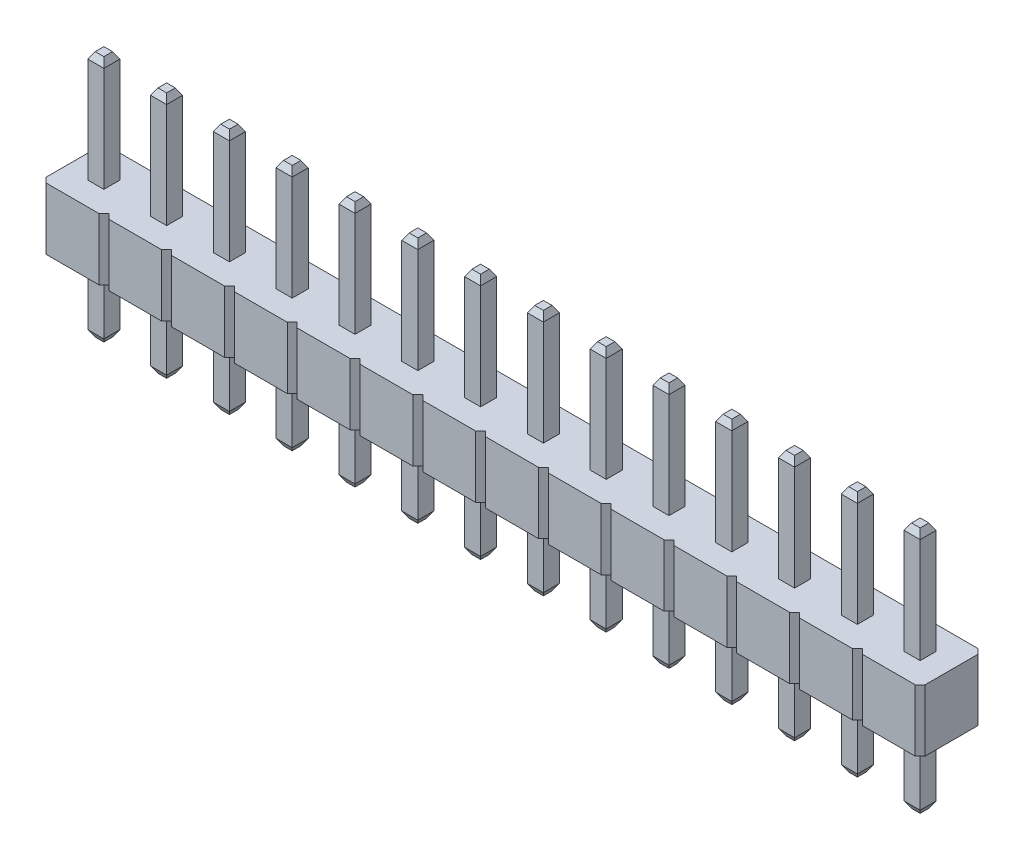
from build123d import *

# Parameters (mm, degrees)
BOSS_EXTRUDE1_DEPTH   = 2.5
SKETCH3_W             = 0.65
SKETCH3_H             = 0.65
BOSS_EXTRUDE2_DEPTH   = 10
CHAMFER2_SIZE         = 0.15
CHAMFER2_SIZE2        = 0.259807621
CHAMFER3_SIZE         = 0.15
CHAMFER3_SIZE2        = 0.259807621
LPATTERN2_DEPTH       = 2.5
LPATTERN2_START       = -2.740192379
LPATTERN2_2_OUTLINE_W = 0.65
LPATTERN2_2_OUTLINE_H = 0.65
LPATTERN2_2_DEPTH     = 9.480384758


with BuildPart() as part:
    # Sketch1 → Boss-Extrude1 (new body)
    with BuildSketch(Plane(origin=(0, 0, 0), x_dir=(1, 0, 0), z_dir=(0, 1, 0))):
        Polygon((-7.42, 1.27), (-7.62, 1.07), (-7.62, -1.07), (-7.42, -1.27), (-5.28, -1.27), (-5.08, -1.07), (-5.08, 1.07), (-5.28, 1.27), align=None)
    extrude(amount=BOSS_EXTRUDE1_DEPTH)

    # Sketch3 → Boss-Extrude2 (add)
    with BuildSketch(Plane(origin=(0, -3, 0), x_dir=(1, 0, 0), z_dir=(0, 1, 0))):
        with Locations((-6.35, 0)):
            Rectangle(SKETCH3_W, SKETCH3_H)
    extrude(amount=BOSS_EXTRUDE2_DEPTH)

    # Chamfer2
    chamfer2_edges = [part.edges().sort_by_distance(p)[0] for p in [
        (-6.025, -3, 0),
        (-6.35, -3, -0.325),
        (-6.675, -3, 0),
        (-6.35, -3, 0.325),
    ]]
    chamfer2_side = [part.faces().sort_by_distance(p)[0] for p in [
        (-6.35, -3, 0),
    ]]
    chamfer(chamfer2_edges, length=CHAMFER2_SIZE, length2=CHAMFER2_SIZE2, reference=chamfer2_side[0])

    # Chamfer3
    chamfer3_edges = [part.edges().sort_by_distance(p)[0] for p in [
        (-6.025, 7, 0),
        (-6.35, 7, -0.325),
        (-6.675, 7, 0),
        (-6.35, 7, 0.325),
    ]]
    chamfer3_side = [part.faces().sort_by_distance(p)[0] for p in [
        (-6.35, 7, 0),
    ]]
    chamfer(chamfer3_edges, length=CHAMFER3_SIZE, length2=CHAMFER3_SIZE2, reference=chamfer3_side[0])

    # LPattern2: read off the stored shape, not the designer's step
    # LPattern2 outline → LPattern2 (add)
    with BuildSketch(Plane(origin=(0, 0, 0), x_dir=(1, 0, 0), z_dir=(0, 1, 0))):
        Polygon((-2.74, 1.27), (-4.88, 1.27), (-5.08, 1.07), (-5.08, -1.07), (-4.88, -1.27), (-2.74, -1.27), (-2.54, -1.07), (-2.34, -1.27), (-0.2, -1.27), (0, -1.07), (0.2, -1.27), (2.34, -1.27), (2.54, -1.07), (2.74, -1.27), (4.88, -1.27), (5.08, -1.07), (5.28, -1.27), (7.42, -1.27), (7.62, -1.07), (7.82, -1.27), (9.96, -1.27), (10.16, -1.07), (10.36, -1.27), (12.5, -1.27), (12.7, -1.07), (12.9, -1.27), (15.04, -1.27), (15.24, -1.07), (15.44, -1.27), (17.58, -1.27), (17.78, -1.07), (17.98, -1.27), (20.12, -1.27), (20.32, -1.07), (20.52, -1.27), (22.66, -1.27), (22.86, -1.07), (23.06, -1.27), (25.2, -1.27), (25.4, -1.07), (25.6, -1.27), (27.74, -1.27), (27.94, -1.07), (27.94, 1.07), (27.74, 1.27), (25.6, 1.27), (25.4, 1.07), (25.2, 1.27), (23.06, 1.27), (22.86, 1.07), (22.66, 1.27), (20.52, 1.27), (20.32, 1.07), (20.12, 1.27), (17.98, 1.27), (17.78, 1.07), (17.58, 1.27), (15.44, 1.27), (15.24, 1.07), (15.04, 1.27), (12.9, 1.27), (12.7, 1.07), (12.5, 1.27), (10.36, 1.27), (10.16, 1.07), (9.96, 1.27), (7.82, 1.27), (7.62, 1.07), (7.42, 1.27), (5.28, 1.27), (5.08, 1.07), (4.88, 1.27), (2.74, 1.27), (2.54, 1.07), (2.34, 1.27), (0.2, 1.27), (0, 1.07), (-0.2, 1.27), (-2.34, 1.27), (-2.54, 1.07), align=None)
    extrude(amount=LPATTERN2_DEPTH)

    # LPattern2 2 outline → LPattern2 2 (add)
    with BuildSketch(Plane(origin=(0, 0, 0), x_dir=(1, 0, 0), z_dir=(0, 1, 0)).offset(LPATTERN2_START)):
        with Locations((-3.81, 0)):
            Rectangle(LPATTERN2_2_OUTLINE_W, LPATTERN2_2_OUTLINE_H)
        with Locations((-1.27, 0)):
            Rectangle(LPATTERN2_2_OUTLINE_W, LPATTERN2_2_OUTLINE_H)
        with Locations((1.27, 0)):
            Rectangle(LPATTERN2_2_OUTLINE_W, LPATTERN2_2_OUTLINE_H)
        with Locations((3.81, 0)):
            Rectangle(LPATTERN2_2_OUTLINE_W, LPATTERN2_2_OUTLINE_H)
        with Locations((6.35, 0)):
            Rectangle(LPATTERN2_2_OUTLINE_W, LPATTERN2_2_OUTLINE_H)
        with Locations((8.89, 0)):
            Rectangle(LPATTERN2_2_OUTLINE_W, LPATTERN2_2_OUTLINE_H)
        with Locations((11.43, 0)):
            Rectangle(LPATTERN2_2_OUTLINE_W, LPATTERN2_2_OUTLINE_H)
        with Locations((13.97, 0)):
            Rectangle(LPATTERN2_2_OUTLINE_W, LPATTERN2_2_OUTLINE_H)
        with Locations((16.51, 0)):
            Rectangle(LPATTERN2_2_OUTLINE_W, LPATTERN2_2_OUTLINE_H)
        with Locations((19.05, 0)):
            Rectangle(LPATTERN2_2_OUTLINE_W, LPATTERN2_2_OUTLINE_H)
        with Locations((21.59, 0)):
            Rectangle(LPATTERN2_2_OUTLINE_W, LPATTERN2_2_OUTLINE_H)
        with Locations((24.13, 0)):
            Rectangle(LPATTERN2_2_OUTLINE_W, LPATTERN2_2_OUTLINE_H)
        with Locations((26.67, 0)):
            Rectangle(LPATTERN2_2_OUTLINE_W, LPATTERN2_2_OUTLINE_H)
    extrude(amount=LPATTERN2_2_DEPTH)

    # LPattern2 3: loft between two sections, ruled curve by curve
    lpattern2_3_from = [
        Edge.make_line((-3.985, -3, 0.175), (-3.635, -3, 0.175)),
        Edge.make_line((-3.635, -3, -0.175), (-3.985, -3, -0.175)),
        Edge.make_line((-3.635, -3, 0.175), (-3.635, -3, -0.175)),
        Edge.make_line((-3.985, -3, 0.175), (-3.985, -3, -0.175)),
    ]
    lpattern2_3_to = [
        Edge.make_line((-4.135, -2.740192379, 0.325), (-3.485, -2.740192379, 0.325)),
        Edge.make_line((-3.485, -2.740192379, -0.325), (-4.135, -2.740192379, -0.325)),
        Edge.make_line((-3.485, -2.740192379, 0.325), (-3.485, -2.740192379, -0.325)),
        Edge.make_line((-4.135, -2.740192379, 0.325), (-4.135, -2.740192379, -0.325)),
    ]
    lpattern2_3 = Solid(Shell([*[Face.make_surface_from_curves(lpattern2_3_from[k], lpattern2_3_to[k]) for k in range(4)], Face(Wire(lpattern2_3_from)), Face(Wire(lpattern2_3_to))]))
    add(lpattern2_3)

    # LPattern2 4: loft between two sections, ruled curve by curve
    lpattern2_4_from = [
        Edge.make_line((-1.445, -3, 0.175), (-1.095, -3, 0.175)),
        Edge.make_line((-1.095, -3, -0.175), (-1.445, -3, -0.175)),
        Edge.make_line((-1.095, -3, 0.175), (-1.095, -3, -0.175)),
        Edge.make_line((-1.445, -3, 0.175), (-1.445, -3, -0.175)),
    ]
    lpattern2_4_to = [
        Edge.make_line((-1.595, -2.740192379, 0.325), (-0.945, -2.740192379, 0.325)),
        Edge.make_line((-0.945, -2.740192379, -0.325), (-1.595, -2.740192379, -0.325)),
        Edge.make_line((-0.945, -2.740192379, 0.325), (-0.945, -2.740192379, -0.325)),
        Edge.make_line((-1.595, -2.740192379, 0.325), (-1.595, -2.740192379, -0.325)),
    ]
    lpattern2_4 = Solid(Shell([*[Face.make_surface_from_curves(lpattern2_4_from[k], lpattern2_4_to[k]) for k in range(4)], Face(Wire(lpattern2_4_from)), Face(Wire(lpattern2_4_to))]))
    add(lpattern2_4)

    # LPattern2 5: loft between two sections, ruled curve by curve
    lpattern2_5_from = [
        Edge.make_line((1.095, -3, 0.175), (1.445, -3, 0.175)),
        Edge.make_line((1.445, -3, -0.175), (1.095, -3, -0.175)),
        Edge.make_line((1.445, -3, 0.175), (1.445, -3, -0.175)),
        Edge.make_line((1.095, -3, 0.175), (1.095, -3, -0.175)),
    ]
    lpattern2_5_to = [
        Edge.make_line((0.945, -2.740192379, 0.325), (1.595, -2.740192379, 0.325)),
        Edge.make_line((1.595, -2.740192379, -0.325), (0.945, -2.740192379, -0.325)),
        Edge.make_line((1.595, -2.740192379, 0.325), (1.595, -2.740192379, -0.325)),
        Edge.make_line((0.945, -2.740192379, 0.325), (0.945, -2.740192379, -0.325)),
    ]
    lpattern2_5 = Solid(Shell([*[Face.make_surface_from_curves(lpattern2_5_from[k], lpattern2_5_to[k]) for k in range(4)], Face(Wire(lpattern2_5_from)), Face(Wire(lpattern2_5_to))]))
    add(lpattern2_5)

    # LPattern2 6: loft between two sections, ruled curve by curve
    lpattern2_6_from = [
        Edge.make_line((3.635, -3, 0.175), (3.985, -3, 0.175)),
        Edge.make_line((3.985, -3, -0.175), (3.635, -3, -0.175)),
        Edge.make_line((3.985, -3, 0.175), (3.985, -3, -0.175)),
        Edge.make_line((3.635, -3, 0.175), (3.635, -3, -0.175)),
    ]
    lpattern2_6_to = [
        Edge.make_line((3.485, -2.740192379, 0.325), (4.135, -2.740192379, 0.325)),
        Edge.make_line((4.135, -2.740192379, -0.325), (3.485, -2.740192379, -0.325)),
        Edge.make_line((4.135, -2.740192379, 0.325), (4.135, -2.740192379, -0.325)),
        Edge.make_line((3.485, -2.740192379, 0.325), (3.485, -2.740192379, -0.325)),
    ]
    lpattern2_6 = Solid(Shell([*[Face.make_surface_from_curves(lpattern2_6_from[k], lpattern2_6_to[k]) for k in range(4)], Face(Wire(lpattern2_6_from)), Face(Wire(lpattern2_6_to))]))
    add(lpattern2_6)

    # LPattern2 7: loft between two sections, ruled curve by curve
    lpattern2_7_from = [
        Edge.make_line((6.175, -3, 0.175), (6.525, -3, 0.175)),
        Edge.make_line((6.525, -3, -0.175), (6.175, -3, -0.175)),
        Edge.make_line((6.525, -3, 0.175), (6.525, -3, -0.175)),
        Edge.make_line((6.175, -3, 0.175), (6.175, -3, -0.175)),
    ]
    lpattern2_7_to = [
        Edge.make_line((6.025, -2.740192379, 0.325), (6.675, -2.740192379, 0.325)),
        Edge.make_line((6.675, -2.740192379, -0.325), (6.025, -2.740192379, -0.325)),
        Edge.make_line((6.675, -2.740192379, 0.325), (6.675, -2.740192379, -0.325)),
        Edge.make_line((6.025, -2.740192379, 0.325), (6.025, -2.740192379, -0.325)),
    ]
    lpattern2_7 = Solid(Shell([*[Face.make_surface_from_curves(lpattern2_7_from[k], lpattern2_7_to[k]) for k in range(4)], Face(Wire(lpattern2_7_from)), Face(Wire(lpattern2_7_to))]))
    add(lpattern2_7)

    # LPattern2 8: loft between two sections, ruled curve by curve
    lpattern2_8_from = [
        Edge.make_line((8.715, -3, 0.175), (9.065, -3, 0.175)),
        Edge.make_line((9.065, -3, -0.175), (8.715, -3, -0.175)),
        Edge.make_line((9.065, -3, 0.175), (9.065, -3, -0.175)),
        Edge.make_line((8.715, -3, 0.175), (8.715, -3, -0.175)),
    ]
    lpattern2_8_to = [
        Edge.make_line((8.565, -2.740192379, 0.325), (9.215, -2.740192379, 0.325)),
        Edge.make_line((9.215, -2.740192379, -0.325), (8.565, -2.740192379, -0.325)),
        Edge.make_line((9.215, -2.740192379, 0.325), (9.215, -2.740192379, -0.325)),
        Edge.make_line((8.565, -2.740192379, 0.325), (8.565, -2.740192379, -0.325)),
    ]
    lpattern2_8 = Solid(Shell([*[Face.make_surface_from_curves(lpattern2_8_from[k], lpattern2_8_to[k]) for k in range(4)], Face(Wire(lpattern2_8_from)), Face(Wire(lpattern2_8_to))]))
    add(lpattern2_8)

    # LPattern2 9: loft between two sections, ruled curve by curve
    lpattern2_9_from = [
        Edge.make_line((11.255, -3, 0.175), (11.605, -3, 0.175)),
        Edge.make_line((11.605, -3, -0.175), (11.255, -3, -0.175)),
        Edge.make_line((11.605, -3, 0.175), (11.605, -3, -0.175)),
        Edge.make_line((11.255, -3, 0.175), (11.255, -3, -0.175)),
    ]
    lpattern2_9_to = [
        Edge.make_line((11.105, -2.740192379, 0.325), (11.755, -2.740192379, 0.325)),
        Edge.make_line((11.755, -2.740192379, -0.325), (11.105, -2.740192379, -0.325)),
        Edge.make_line((11.755, -2.740192379, 0.325), (11.755, -2.740192379, -0.325)),
        Edge.make_line((11.105, -2.740192379, 0.325), (11.105, -2.740192379, -0.325)),
    ]
    lpattern2_9 = Solid(Shell([*[Face.make_surface_from_curves(lpattern2_9_from[k], lpattern2_9_to[k]) for k in range(4)], Face(Wire(lpattern2_9_from)), Face(Wire(lpattern2_9_to))]))
    add(lpattern2_9)

    # LPattern2 10: loft between two sections, ruled curve by curve
    lpattern2_10_from = [
        Edge.make_line((13.795, -3, 0.175), (14.145, -3, 0.175)),
        Edge.make_line((14.145, -3, -0.175), (13.795, -3, -0.175)),
        Edge.make_line((14.145, -3, 0.175), (14.145, -3, -0.175)),
        Edge.make_line((13.795, -3, 0.175), (13.795, -3, -0.175)),
    ]
    lpattern2_10_to = [
        Edge.make_line((13.645, -2.740192379, 0.325), (14.295, -2.740192379, 0.325)),
        Edge.make_line((14.295, -2.740192379, -0.325), (13.645, -2.740192379, -0.325)),
        Edge.make_line((14.295, -2.740192379, 0.325), (14.295, -2.740192379, -0.325)),
        Edge.make_line((13.645, -2.740192379, 0.325), (13.645, -2.740192379, -0.325)),
    ]
    lpattern2_10 = Solid(Shell([*[Face.make_surface_from_curves(lpattern2_10_from[k], lpattern2_10_to[k]) for k in range(4)], Face(Wire(lpattern2_10_from)), Face(Wire(lpattern2_10_to))]))
    add(lpattern2_10)

    # LPattern2 11: loft between two sections, ruled curve by curve
    lpattern2_11_from = [
        Edge.make_line((16.335, -3, 0.175), (16.685, -3, 0.175)),
        Edge.make_line((16.685, -3, -0.175), (16.335, -3, -0.175)),
        Edge.make_line((16.685, -3, 0.175), (16.685, -3, -0.175)),
        Edge.make_line((16.335, -3, 0.175), (16.335, -3, -0.175)),
    ]
    lpattern2_11_to = [
        Edge.make_line((16.185, -2.740192379, 0.325), (16.835, -2.740192379, 0.325)),
        Edge.make_line((16.835, -2.740192379, -0.325), (16.185, -2.740192379, -0.325)),
        Edge.make_line((16.835, -2.740192379, 0.325), (16.835, -2.740192379, -0.325)),
        Edge.make_line((16.185, -2.740192379, 0.325), (16.185, -2.740192379, -0.325)),
    ]
    lpattern2_11 = Solid(Shell([*[Face.make_surface_from_curves(lpattern2_11_from[k], lpattern2_11_to[k]) for k in range(4)], Face(Wire(lpattern2_11_from)), Face(Wire(lpattern2_11_to))]))
    add(lpattern2_11)

    # LPattern2 12: loft between two sections, ruled curve by curve
    lpattern2_12_from = [
        Edge.make_line((18.875, -3, 0.175), (19.225, -3, 0.175)),
        Edge.make_line((19.225, -3, -0.175), (18.875, -3, -0.175)),
        Edge.make_line((19.225, -3, 0.175), (19.225, -3, -0.175)),
        Edge.make_line((18.875, -3, 0.175), (18.875, -3, -0.175)),
    ]
    lpattern2_12_to = [
        Edge.make_line((18.725, -2.740192379, 0.325), (19.375, -2.740192379, 0.325)),
        Edge.make_line((19.375, -2.740192379, -0.325), (18.725, -2.740192379, -0.325)),
        Edge.make_line((19.375, -2.740192379, 0.325), (19.375, -2.740192379, -0.325)),
        Edge.make_line((18.725, -2.740192379, 0.325), (18.725, -2.740192379, -0.325)),
    ]
    lpattern2_12 = Solid(Shell([*[Face.make_surface_from_curves(lpattern2_12_from[k], lpattern2_12_to[k]) for k in range(4)], Face(Wire(lpattern2_12_from)), Face(Wire(lpattern2_12_to))]))
    add(lpattern2_12)

    # LPattern2 13: loft between two sections, ruled curve by curve
    lpattern2_13_from = [
        Edge.make_line((21.415, -3, 0.175), (21.765, -3, 0.175)),
        Edge.make_line((21.765, -3, -0.175), (21.415, -3, -0.175)),
        Edge.make_line((21.765, -3, 0.175), (21.765, -3, -0.175)),
        Edge.make_line((21.415, -3, 0.175), (21.415, -3, -0.175)),
    ]
    lpattern2_13_to = [
        Edge.make_line((21.265, -2.740192379, 0.325), (21.915, -2.740192379, 0.325)),
        Edge.make_line((21.915, -2.740192379, -0.325), (21.265, -2.740192379, -0.325)),
        Edge.make_line((21.915, -2.740192379, 0.325), (21.915, -2.740192379, -0.325)),
        Edge.make_line((21.265, -2.740192379, 0.325), (21.265, -2.740192379, -0.325)),
    ]
    lpattern2_13 = Solid(Shell([*[Face.make_surface_from_curves(lpattern2_13_from[k], lpattern2_13_to[k]) for k in range(4)], Face(Wire(lpattern2_13_from)), Face(Wire(lpattern2_13_to))]))
    add(lpattern2_13)

    # LPattern2 14: loft between two sections, ruled curve by curve
    lpattern2_14_from = [
        Edge.make_line((23.955, -3, 0.175), (24.305, -3, 0.175)),
        Edge.make_line((24.305, -3, -0.175), (23.955, -3, -0.175)),
        Edge.make_line((24.305, -3, 0.175), (24.305, -3, -0.175)),
        Edge.make_line((23.955, -3, 0.175), (23.955, -3, -0.175)),
    ]
    lpattern2_14_to = [
        Edge.make_line((23.805, -2.740192379, 0.325), (24.455, -2.740192379, 0.325)),
        Edge.make_line((24.455, -2.740192379, -0.325), (23.805, -2.740192379, -0.325)),
        Edge.make_line((24.455, -2.740192379, 0.325), (24.455, -2.740192379, -0.325)),
        Edge.make_line((23.805, -2.740192379, 0.325), (23.805, -2.740192379, -0.325)),
    ]
    lpattern2_14 = Solid(Shell([*[Face.make_surface_from_curves(lpattern2_14_from[k], lpattern2_14_to[k]) for k in range(4)], Face(Wire(lpattern2_14_from)), Face(Wire(lpattern2_14_to))]))
    add(lpattern2_14)

    # LPattern2 15: loft between two sections, ruled curve by curve
    lpattern2_15_from = [
        Edge.make_line((26.495, -3, 0.175), (26.845, -3, 0.175)),
        Edge.make_line((26.845, -3, -0.175), (26.495, -3, -0.175)),
        Edge.make_line((26.845, -3, 0.175), (26.845, -3, -0.175)),
        Edge.make_line((26.495, -3, 0.175), (26.495, -3, -0.175)),
    ]
    lpattern2_15_to = [
        Edge.make_line((26.345, -2.740192379, 0.325), (26.995, -2.740192379, 0.325)),
        Edge.make_line((26.995, -2.740192379, -0.325), (26.345, -2.740192379, -0.325)),
        Edge.make_line((26.995, -2.740192379, 0.325), (26.995, -2.740192379, -0.325)),
        Edge.make_line((26.345, -2.740192379, 0.325), (26.345, -2.740192379, -0.325)),
    ]
    lpattern2_15 = Solid(Shell([*[Face.make_surface_from_curves(lpattern2_15_from[k], lpattern2_15_to[k]) for k in range(4)], Face(Wire(lpattern2_15_from)), Face(Wire(lpattern2_15_to))]))
    add(lpattern2_15)

    # LPattern2 16: loft between two sections, ruled curve by curve
    lpattern2_16_from = [
        Edge.make_line((-3.485, 6.740192379, -0.325), (-4.135, 6.740192379, -0.325)),
        Edge.make_line((-4.135, 6.740192379, 0.325), (-3.485, 6.740192379, 0.325)),
        Edge.make_line((-4.135, 6.740192379, -0.325), (-4.135, 6.740192379, 0.325)),
        Edge.make_line((-3.485, 6.740192379, -0.325), (-3.485, 6.740192379, 0.325)),
    ]
    lpattern2_16_to = [
        Edge.make_line((-3.635, 7, -0.175), (-3.985, 7, -0.175)),
        Edge.make_line((-3.985, 7, 0.175), (-3.635, 7, 0.175)),
        Edge.make_line((-3.985, 7, -0.175), (-3.985, 7, 0.175)),
        Edge.make_line((-3.635, 7, -0.175), (-3.635, 7, 0.175)),
    ]
    lpattern2_16 = Solid(Shell([*[Face.make_surface_from_curves(lpattern2_16_from[k], lpattern2_16_to[k]) for k in range(4)], Face(Wire(lpattern2_16_from)), Face(Wire(lpattern2_16_to))]))
    add(lpattern2_16)

    # LPattern2 17: loft between two sections, ruled curve by curve
    lpattern2_17_from = [
        Edge.make_line((-0.945, 6.740192379, -0.325), (-1.595, 6.740192379, -0.325)),
        Edge.make_line((-1.595, 6.740192379, 0.325), (-0.945, 6.740192379, 0.325)),
        Edge.make_line((-1.595, 6.740192379, -0.325), (-1.595, 6.740192379, 0.325)),
        Edge.make_line((-0.945, 6.740192379, -0.325), (-0.945, 6.740192379, 0.325)),
    ]
    lpattern2_17_to = [
        Edge.make_line((-1.095, 7, -0.175), (-1.445, 7, -0.175)),
        Edge.make_line((-1.445, 7, 0.175), (-1.095, 7, 0.175)),
        Edge.make_line((-1.445, 7, -0.175), (-1.445, 7, 0.175)),
        Edge.make_line((-1.095, 7, -0.175), (-1.095, 7, 0.175)),
    ]
    lpattern2_17 = Solid(Shell([*[Face.make_surface_from_curves(lpattern2_17_from[k], lpattern2_17_to[k]) for k in range(4)], Face(Wire(lpattern2_17_from)), Face(Wire(lpattern2_17_to))]))
    add(lpattern2_17)

    # LPattern2 18: loft between two sections, ruled curve by curve
    lpattern2_18_from = [
        Edge.make_line((1.595, 6.740192379, -0.325), (0.945, 6.740192379, -0.325)),
        Edge.make_line((0.945, 6.740192379, 0.325), (1.595, 6.740192379, 0.325)),
        Edge.make_line((0.945, 6.740192379, -0.325), (0.945, 6.740192379, 0.325)),
        Edge.make_line((1.595, 6.740192379, -0.325), (1.595, 6.740192379, 0.325)),
    ]
    lpattern2_18_to = [
        Edge.make_line((1.445, 7, -0.175), (1.095, 7, -0.175)),
        Edge.make_line((1.095, 7, 0.175), (1.445, 7, 0.175)),
        Edge.make_line((1.095, 7, -0.175), (1.095, 7, 0.175)),
        Edge.make_line((1.445, 7, -0.175), (1.445, 7, 0.175)),
    ]
    lpattern2_18 = Solid(Shell([*[Face.make_surface_from_curves(lpattern2_18_from[k], lpattern2_18_to[k]) for k in range(4)], Face(Wire(lpattern2_18_from)), Face(Wire(lpattern2_18_to))]))
    add(lpattern2_18)

    # LPattern2 19: loft between two sections, ruled curve by curve
    lpattern2_19_from = [
        Edge.make_line((4.135, 6.740192379, -0.325), (3.485, 6.740192379, -0.325)),
        Edge.make_line((3.485, 6.740192379, 0.325), (4.135, 6.740192379, 0.325)),
        Edge.make_line((3.485, 6.740192379, -0.325), (3.485, 6.740192379, 0.325)),
        Edge.make_line((4.135, 6.740192379, -0.325), (4.135, 6.740192379, 0.325)),
    ]
    lpattern2_19_to = [
        Edge.make_line((3.985, 7, -0.175), (3.635, 7, -0.175)),
        Edge.make_line((3.635, 7, 0.175), (3.985, 7, 0.175)),
        Edge.make_line((3.635, 7, -0.175), (3.635, 7, 0.175)),
        Edge.make_line((3.985, 7, -0.175), (3.985, 7, 0.175)),
    ]
    lpattern2_19 = Solid(Shell([*[Face.make_surface_from_curves(lpattern2_19_from[k], lpattern2_19_to[k]) for k in range(4)], Face(Wire(lpattern2_19_from)), Face(Wire(lpattern2_19_to))]))
    add(lpattern2_19)

    # LPattern2 20: loft between two sections, ruled curve by curve
    lpattern2_20_from = [
        Edge.make_line((6.675, 6.740192379, -0.325), (6.025, 6.740192379, -0.325)),
        Edge.make_line((6.025, 6.740192379, 0.325), (6.675, 6.740192379, 0.325)),
        Edge.make_line((6.025, 6.740192379, -0.325), (6.025, 6.740192379, 0.325)),
        Edge.make_line((6.675, 6.740192379, -0.325), (6.675, 6.740192379, 0.325)),
    ]
    lpattern2_20_to = [
        Edge.make_line((6.525, 7, -0.175), (6.175, 7, -0.175)),
        Edge.make_line((6.175, 7, 0.175), (6.525, 7, 0.175)),
        Edge.make_line((6.175, 7, -0.175), (6.175, 7, 0.175)),
        Edge.make_line((6.525, 7, -0.175), (6.525, 7, 0.175)),
    ]
    lpattern2_20 = Solid(Shell([*[Face.make_surface_from_curves(lpattern2_20_from[k], lpattern2_20_to[k]) for k in range(4)], Face(Wire(lpattern2_20_from)), Face(Wire(lpattern2_20_to))]))
    add(lpattern2_20)

    # LPattern2 21: loft between two sections, ruled curve by curve
    lpattern2_21_from = [
        Edge.make_line((9.215, 6.740192379, -0.325), (8.565, 6.740192379, -0.325)),
        Edge.make_line((8.565, 6.740192379, 0.325), (9.215, 6.740192379, 0.325)),
        Edge.make_line((8.565, 6.740192379, -0.325), (8.565, 6.740192379, 0.325)),
        Edge.make_line((9.215, 6.740192379, -0.325), (9.215, 6.740192379, 0.325)),
    ]
    lpattern2_21_to = [
        Edge.make_line((9.065, 7, -0.175), (8.715, 7, -0.175)),
        Edge.make_line((8.715, 7, 0.175), (9.065, 7, 0.175)),
        Edge.make_line((8.715, 7, -0.175), (8.715, 7, 0.175)),
        Edge.make_line((9.065, 7, -0.175), (9.065, 7, 0.175)),
    ]
    lpattern2_21 = Solid(Shell([*[Face.make_surface_from_curves(lpattern2_21_from[k], lpattern2_21_to[k]) for k in range(4)], Face(Wire(lpattern2_21_from)), Face(Wire(lpattern2_21_to))]))
    add(lpattern2_21)

    # LPattern2 22: loft between two sections, ruled curve by curve
    lpattern2_22_from = [
        Edge.make_line((11.755, 6.740192379, -0.325), (11.105, 6.740192379, -0.325)),
        Edge.make_line((11.105, 6.740192379, 0.325), (11.755, 6.740192379, 0.325)),
        Edge.make_line((11.105, 6.740192379, -0.325), (11.105, 6.740192379, 0.325)),
        Edge.make_line((11.755, 6.740192379, -0.325), (11.755, 6.740192379, 0.325)),
    ]
    lpattern2_22_to = [
        Edge.make_line((11.605, 7, -0.175), (11.255, 7, -0.175)),
        Edge.make_line((11.255, 7, 0.175), (11.605, 7, 0.175)),
        Edge.make_line((11.255, 7, -0.175), (11.255, 7, 0.175)),
        Edge.make_line((11.605, 7, -0.175), (11.605, 7, 0.175)),
    ]
    lpattern2_22 = Solid(Shell([*[Face.make_surface_from_curves(lpattern2_22_from[k], lpattern2_22_to[k]) for k in range(4)], Face(Wire(lpattern2_22_from)), Face(Wire(lpattern2_22_to))]))
    add(lpattern2_22)

    # LPattern2 23: loft between two sections, ruled curve by curve
    lpattern2_23_from = [
        Edge.make_line((14.295, 6.740192379, -0.325), (13.645, 6.740192379, -0.325)),
        Edge.make_line((13.645, 6.740192379, 0.325), (14.295, 6.740192379, 0.325)),
        Edge.make_line((13.645, 6.740192379, -0.325), (13.645, 6.740192379, 0.325)),
        Edge.make_line((14.295, 6.740192379, -0.325), (14.295, 6.740192379, 0.325)),
    ]
    lpattern2_23_to = [
        Edge.make_line((14.145, 7, -0.175), (13.795, 7, -0.175)),
        Edge.make_line((13.795, 7, 0.175), (14.145, 7, 0.175)),
        Edge.make_line((13.795, 7, -0.175), (13.795, 7, 0.175)),
        Edge.make_line((14.145, 7, -0.175), (14.145, 7, 0.175)),
    ]
    lpattern2_23 = Solid(Shell([*[Face.make_surface_from_curves(lpattern2_23_from[k], lpattern2_23_to[k]) for k in range(4)], Face(Wire(lpattern2_23_from)), Face(Wire(lpattern2_23_to))]))
    add(lpattern2_23)

    # LPattern2 24: loft between two sections, ruled curve by curve
    lpattern2_24_from = [
        Edge.make_line((16.835, 6.740192379, -0.325), (16.185, 6.740192379, -0.325)),
        Edge.make_line((16.185, 6.740192379, 0.325), (16.835, 6.740192379, 0.325)),
        Edge.make_line((16.185, 6.740192379, -0.325), (16.185, 6.740192379, 0.325)),
        Edge.make_line((16.835, 6.740192379, -0.325), (16.835, 6.740192379, 0.325)),
    ]
    lpattern2_24_to = [
        Edge.make_line((16.685, 7, -0.175), (16.335, 7, -0.175)),
        Edge.make_line((16.335, 7, 0.175), (16.685, 7, 0.175)),
        Edge.make_line((16.335, 7, -0.175), (16.335, 7, 0.175)),
        Edge.make_line((16.685, 7, -0.175), (16.685, 7, 0.175)),
    ]
    lpattern2_24 = Solid(Shell([*[Face.make_surface_from_curves(lpattern2_24_from[k], lpattern2_24_to[k]) for k in range(4)], Face(Wire(lpattern2_24_from)), Face(Wire(lpattern2_24_to))]))
    add(lpattern2_24)

    # LPattern2 25: loft between two sections, ruled curve by curve
    lpattern2_25_from = [
        Edge.make_line((19.375, 6.740192379, -0.325), (18.725, 6.740192379, -0.325)),
        Edge.make_line((18.725, 6.740192379, 0.325), (19.375, 6.740192379, 0.325)),
        Edge.make_line((18.725, 6.740192379, -0.325), (18.725, 6.740192379, 0.325)),
        Edge.make_line((19.375, 6.740192379, -0.325), (19.375, 6.740192379, 0.325)),
    ]
    lpattern2_25_to = [
        Edge.make_line((19.225, 7, -0.175), (18.875, 7, -0.175)),
        Edge.make_line((18.875, 7, 0.175), (19.225, 7, 0.175)),
        Edge.make_line((18.875, 7, -0.175), (18.875, 7, 0.175)),
        Edge.make_line((19.225, 7, -0.175), (19.225, 7, 0.175)),
    ]
    lpattern2_25 = Solid(Shell([*[Face.make_surface_from_curves(lpattern2_25_from[k], lpattern2_25_to[k]) for k in range(4)], Face(Wire(lpattern2_25_from)), Face(Wire(lpattern2_25_to))]))
    add(lpattern2_25)

    # LPattern2 26: loft between two sections, ruled curve by curve
    lpattern2_26_from = [
        Edge.make_line((21.915, 6.740192379, -0.325), (21.265, 6.740192379, -0.325)),
        Edge.make_line((21.265, 6.740192379, 0.325), (21.915, 6.740192379, 0.325)),
        Edge.make_line((21.265, 6.740192379, -0.325), (21.265, 6.740192379, 0.325)),
        Edge.make_line((21.915, 6.740192379, -0.325), (21.915, 6.740192379, 0.325)),
    ]
    lpattern2_26_to = [
        Edge.make_line((21.765, 7, -0.175), (21.415, 7, -0.175)),
        Edge.make_line((21.415, 7, 0.175), (21.765, 7, 0.175)),
        Edge.make_line((21.415, 7, -0.175), (21.415, 7, 0.175)),
        Edge.make_line((21.765, 7, -0.175), (21.765, 7, 0.175)),
    ]
    lpattern2_26 = Solid(Shell([*[Face.make_surface_from_curves(lpattern2_26_from[k], lpattern2_26_to[k]) for k in range(4)], Face(Wire(lpattern2_26_from)), Face(Wire(lpattern2_26_to))]))
    add(lpattern2_26)

    # LPattern2 27: loft between two sections, ruled curve by curve
    lpattern2_27_from = [
        Edge.make_line((24.455, 6.740192379, -0.325), (23.805, 6.740192379, -0.325)),
        Edge.make_line((23.805, 6.740192379, 0.325), (24.455, 6.740192379, 0.325)),
        Edge.make_line((23.805, 6.740192379, -0.325), (23.805, 6.740192379, 0.325)),
        Edge.make_line((24.455, 6.740192379, -0.325), (24.455, 6.740192379, 0.325)),
    ]
    lpattern2_27_to = [
        Edge.make_line((24.305, 7, -0.175), (23.955, 7, -0.175)),
        Edge.make_line((23.955, 7, 0.175), (24.305, 7, 0.175)),
        Edge.make_line((23.955, 7, -0.175), (23.955, 7, 0.175)),
        Edge.make_line((24.305, 7, -0.175), (24.305, 7, 0.175)),
    ]
    lpattern2_27 = Solid(Shell([*[Face.make_surface_from_curves(lpattern2_27_from[k], lpattern2_27_to[k]) for k in range(4)], Face(Wire(lpattern2_27_from)), Face(Wire(lpattern2_27_to))]))
    add(lpattern2_27)

    # LPattern2 28: loft between two sections, ruled curve by curve
    lpattern2_28_from = [
        Edge.make_line((26.995, 6.740192379, -0.325), (26.345, 6.740192379, -0.325)),
        Edge.make_line((26.345, 6.740192379, 0.325), (26.995, 6.740192379, 0.325)),
        Edge.make_line((26.345, 6.740192379, -0.325), (26.345, 6.740192379, 0.325)),
        Edge.make_line((26.995, 6.740192379, -0.325), (26.995, 6.740192379, 0.325)),
    ]
    lpattern2_28_to = [
        Edge.make_line((26.845, 7, -0.175), (26.495, 7, -0.175)),
        Edge.make_line((26.495, 7, 0.175), (26.845, 7, 0.175)),
        Edge.make_line((26.495, 7, -0.175), (26.495, 7, 0.175)),
        Edge.make_line((26.845, 7, -0.175), (26.845, 7, 0.175)),
    ]
    lpattern2_28 = Solid(Shell([*[Face.make_surface_from_curves(lpattern2_28_from[k], lpattern2_28_to[k]) for k in range(4)], Face(Wire(lpattern2_28_from)), Face(Wire(lpattern2_28_to))]))
    add(lpattern2_28)


solid = part.part
